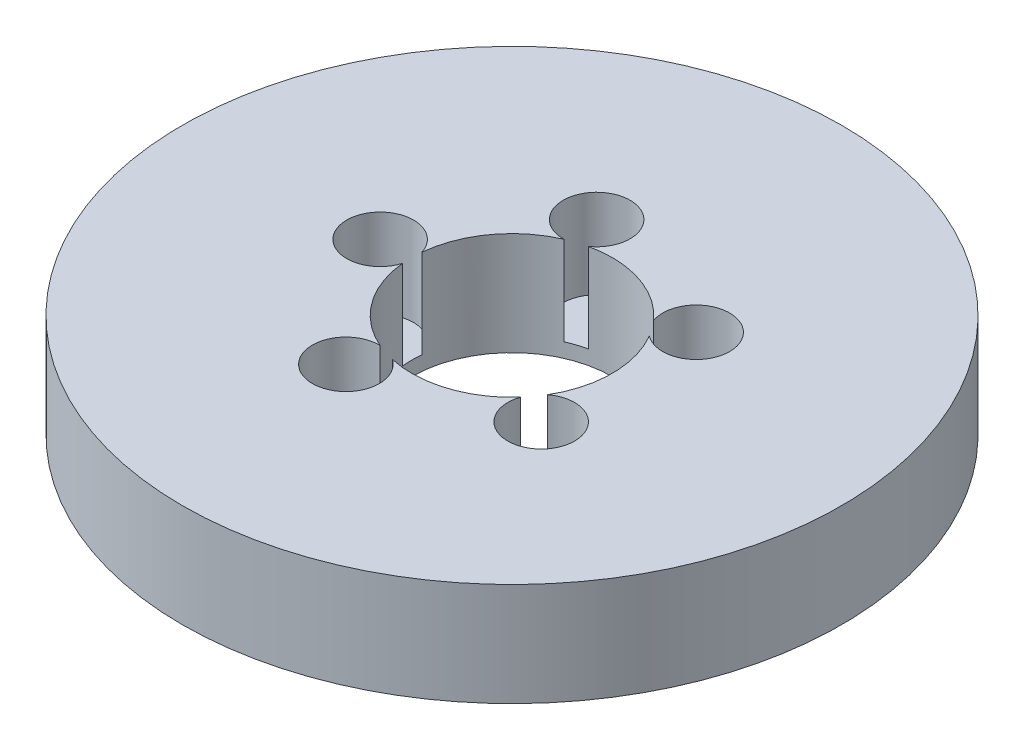
from build123d import *

# Parameters (mm, degrees)
SKETCH1_R           = 57.5
BOSS_EXTRUDE1_DEPTH = 18
SKETCH2_R           = 17.5
CUT_EXTRUDE1_DEPTH  = 84.285653026
SKETCH3_R           = 5.835493776
CUT_EXTRUDE2_DEPTH  = 15.493778772
CIRPATTERN1_COUNT   = 5


with BuildPart() as part:
    # Sketch1 → Boss-Extrude1 (new body)
    with BuildSketch(Plane(origin=(0, 0, 0), x_dir=(1, 0, 0), z_dir=(0, 1, 0))):
        Circle(SKETCH1_R)
    extrude(amount=BOSS_EXTRUDE1_DEPTH)

    # Sketch2 → Cut-Extrude1 (cut, through all)
    with BuildSketch(Plane(origin=(0, 0, 0), x_dir=(1, 0, 0), z_dir=(0, 1, 0))):
        Circle(SKETCH2_R)
    extrude(amount=CUT_EXTRUDE1_DEPTH, mode=Mode.SUBTRACT)

    # Sketch3 → Cut-Extrude2 (cut)
    with BuildSketch(Plane(origin=(0, 18, 0), x_dir=(1, 0, 0), z_dir=(0, 1, 0))):
        with Locations((-23.003411052, 0)):
            Circle(SKETCH3_R)
    cut_extrude2 = extrude(amount=-CUT_EXTRUDE2_DEPTH, mode=Mode.SUBTRACT)

    # CirPattern1: Cut-Extrude2 ×5 about axis
    cirpattern1_axis = Axis((0, 0, 0), (0, 1, 0))
    for i in range(1, CIRPATTERN1_COUNT):
        add(cut_extrude2.rotate(cirpattern1_axis, i * 360 / CIRPATTERN1_COUNT), mode=Mode.SUBTRACT)


solid = part.part
